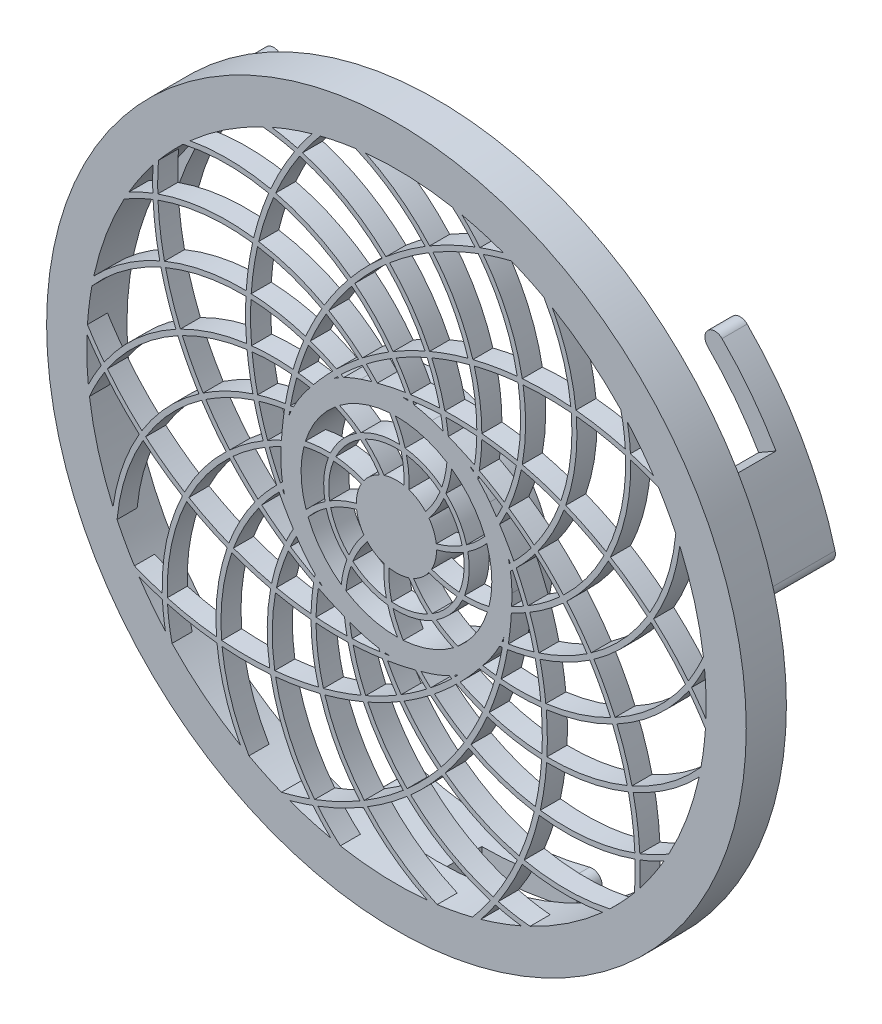
from build123d import *

# Parameters (mm, degrees)
SKETCH_1_R               = 34.85
EXTRUDE_1_DEPTH          = 4
EXTRUDE_2_DEPTH          = 7
SKETCH_2_W               = 4.5
SKETCH_2_H               = 3.119336606
CUT_REVOLVE_1_ANGLE      = 30
PATTERN_CIRCULAR_1_COUNT = 3
SKETCH_3_R               = 30.85
SKETCH_3_R_2             = 11.5
SKETCH_3_R_3             = 9.5
SKETCH_3_R_4             = 4
CUT_EXTRUDE_1_DEPTH      = 51.497970256
EXTRUDE_START            = -2
EXTRUDE_1_2_DEPTH        = 2
EXTRUDE_2_2_DEPTH        = 2
EXTRUDE_3_DEPTH          = 2


# Read off the part's stored shape, not the designer's step: 拉伸-薄壁1
with BuildPart() as part:
    # 草图1 → Extrude 1 (new body)
    with BuildSketch(Plane.XY):
        Circle(SKETCH_1_R)
    extrude(amount=EXTRUDE_1_DEPTH)

    # 草图1<4> → Extrude 2 (add)
    with BuildSketch(Plane.XY):
        with BuildLine():
            ThreePointArc((22.521350971, 22.521350991), (27.582909092, 15.925000032), (30.764737552, 8.243386644))
            ThreePointArc((30.764737552, 8.243386644), (31.989482379, 7.536279789), (32.696589236, 8.761024615))
            ThreePointArc((32.696589236, 8.761024615), (29.314959928, 16.924999982), (23.935564527, 23.935564559))
            ThreePointArc((23.935564527, 23.935564559), (22.521350978, 23.93556454), (22.521350971, 22.521350991))
        make_face()
        with BuildLine():
            ThreePointArc((-8.761024725, -32.696589207), (-5.1e-08, -33.85), (8.761024627, -32.696589233))
            ThreePointArc((8.761024627, -32.696589233), (9.468131465, -31.471844375), (8.24338659, -30.764737566))
            ThreePointArc((8.24338659, -30.764737566), (5.8e-08, -31.85), (-8.243386478, -30.764737596))
            ThreePointArc((-8.243386478, -30.764737596), (-9.468131437, -31.47184427), (-8.761024725, -32.696589207))
        make_face()
        with BuildLine():
            ThreePointArc((-30.764737568, 8.243386584), (-27.582909111, 15.924999999), (-22.521350981, 22.521350981))
            ThreePointArc((-22.521350981, 22.521350981), (-22.52135097, 23.935564533), (-23.935564523, 23.935564564))
            ThreePointArc((-23.935564523, 23.935564564), (-29.314959921, 16.924999995), (-32.69658923, 8.761024638))
            ThreePointArc((-32.69658923, 8.761024638), (-31.989482421, 7.536279801), (-30.764737568, 8.243386584))
        make_face()
    extrude(amount=-EXTRUDE_2_DEPTH)

    # 草图2 → 切除-旋转1 (revolve, cut)
    with BuildSketch(Plane(origin=(0, 0, 0), x_dir=(0, 0, -1), z_dir=(1, 0, 0))):
        with Locations((2.25, -32.290331697)):
            Rectangle(SKETCH_2_W, SKETCH_2_H)
    cut_revolve_1 = revolve(axis=Axis((0, 0, 0), (0, 0, 1)), revolution_arc=CUT_REVOLVE_1_ANGLE, mode=Mode.SUBTRACT)

    # 阵列(圆周)1: 切除-旋转1 ×3 about axis
    pattern_circular_1_axis = Axis((0, 0, 0), (0, 0, 1))
    for i in range(1, PATTERN_CIRCULAR_1_COUNT):
        add(cut_revolve_1.rotate(pattern_circular_1_axis, i * 360 / PATTERN_CIRCULAR_1_COUNT), mode=Mode.SUBTRACT)

    # 草图3 → 切除-拉伸1 (cut, through all)
    # profile 1 of 2: a face of its own
    with BuildSketch(Plane.XY.offset(4)):
        Circle(SKETCH_3_R)
        Circle(SKETCH_3_R_2, mode=Mode.SUBTRACT)
    # profile 2 of 2: a face of its own
    with BuildSketch(Plane.XY.offset(4)):
        Circle(SKETCH_3_R_3)
        Circle(SKETCH_3_R_4, mode=Mode.SUBTRACT)
    extrude(amount=-CUT_EXTRUDE_1_DEPTH, mode=Mode.SUBTRACT)


with BuildPart() as cut_extrude_1_piece_1:
    # of the separate pieces the step leaves, piece 1, a body of its own (cut_extrude_1_pieces)
    add(part.part.solids().sort_by_distance((34.85, 0, 0))[0])



with BuildPart() as cut_extrude_1_piece_2:
    # of the separate pieces the step leaves, piece 2, a body of its own (cut_extrude_1_pieces)
    add(part.part.solids().sort_by_distance((11.5, 0, 0))[0])



with BuildPart() as cut_extrude_1_piece_3:
    # of the separate pieces the step leaves, piece 3, a body of its own (cut_extrude_1_pieces)
    add(part.part.solids().sort_by_distance((4, 0, 0))[0])


with BuildPart() as cut_extrude_1_piece_2_1:
    add(cut_extrude_1_piece_2.part)

    add(cut_extrude_1_piece_3.part)  # Extrude 1 2 merges 切除-拉伸1 piece 3
    # Extrude 1 2 outline → Extrude 1 2 (add)
    with BuildSketch(Plane.XY.offset(4).offset(EXTRUDE_START)):
        with BuildLine():
            ThreePointArc((-6.114773729, 7.270456811), (-5.012586681, 6.729953616), (-3.987053322, 6.055237882))
            ThreePointArc((-3.987053322, 6.055237882), (-5.491731551, 4.733221375), (-6.577258445, 3.049946121))
            ThreePointArc((-6.577258445, 3.049946121), (-7.828797496, 3.018565511), (-9.067175577, 2.834841628))
            ThreePointArc((-9.067175577, 2.834841628), (-9.147890158, 2.562441346), (-9.220423155, 2.287749298))
            ThreePointArc((-9.220423155, 2.287749298), (-8.011035295, 2.498322319), (-6.784773421, 2.555259208))
            ThreePointArc((-6.784773421, 2.555259208), (-7.225021873, 0.601297715), (-7.113827209, -1.398557271))
            ThreePointArc((-7.113827209, -1.398557271), (-8.10789851, -2.159580914), (-9.001777234, -3.03611703))
            ThreePointArc((-9.001777234, -3.03611703), (-8.906963834, -3.303936328), (-8.804184326, -3.568800689))
            ThreePointArc((-8.804184326, -3.568800689), (-7.949540711, -2.687583188), (-6.990940679, -1.920741633))
            ThreePointArc((-6.990940679, -1.920741633), (-6.198599409, -3.760301235), (-4.933155769, -5.312859321))
            ThreePointArc((-4.933155769, -5.312859321), (-5.290057871, -6.512840832), (-5.498005948, -7.747382177))
            ThreePointArc((-5.498005948, -7.747382177), (-5.263880062, -7.908322622), (-5.025046328, -8.062190112))
            ThreePointArc((-5.025046328, -8.062190112), (-4.85159177, -6.846923265), (-4.526806211, -5.663084453))
            ThreePointArc((-4.526806211, -5.663084453), (-2.804522654, -6.68559292), (-0.868186497, -7.197829687))
            ThreePointArc((-0.868186497, -7.197829687), (-0.451594928, -8.378416915), (0.105816741, -9.499410656))
            ThreePointArc((0.105816741, -9.499410656), (0.389826981, -9.491998468), (0.673488572, -9.476096936))
            ThreePointArc((0.673488572, -9.476096936), (0.099500327, -8.390971373), (-0.333585631, -7.242321494))
            ThreePointArc((-0.333585631, -7.242321494), (1.660786433, -7.057215345), (3.528400508, -6.333473759))
            ThreePointArc((3.528400508, -6.333473759), (4.559361929, -7.043722509), (5.669221031, -7.622987138))
            ThreePointArc((5.669221031, -7.622987138), (5.894633367, -7.450053521), (6.114773729, -7.270456811))
            ThreePointArc((6.114773729, -7.270456811), (5.012586681, -6.729953616), (3.987053322, -6.055237882))
            ThreePointArc((3.987053322, -6.055237882), (5.491731551, -4.733221375), (6.577258445, -3.049946121))
            ThreePointArc((6.577258445, -3.049946121), (7.828797496, -3.018565511), (9.067175577, -2.834841628))
            ThreePointArc((9.067175577, -2.834841628), (9.147890158, -2.562441346), (9.220423155, -2.287749298))
            ThreePointArc((9.220423155, -2.287749298), (8.011035295, -2.498322319), (6.784773421, -2.555259208))
            ThreePointArc((6.784773421, -2.555259208), (7.225021873, -0.601297715), (7.113827209, 1.398557271))
            ThreePointArc((7.113827209, 1.398557271), (8.10789851, 2.159580914), (9.001777234, 3.03611703))
            ThreePointArc((9.001777234, 3.03611703), (8.906963834, 3.303936328), (8.804184326, 3.568800689))
            ThreePointArc((8.804184326, 3.568800689), (7.949540711, 2.687583188), (6.990940679, 1.920741633))
            ThreePointArc((6.990940679, 1.920741633), (6.198599409, 3.760301235), (4.933155769, 5.312859321))
            ThreePointArc((4.933155769, 5.312859321), (5.290057871, 6.512840832), (5.498005948, 7.747382177))
            ThreePointArc((5.498005948, 7.747382177), (5.263880062, 7.908322622), (5.025046328, 8.062190112))
            ThreePointArc((5.025046328, 8.062190112), (4.85159177, 6.846923265), (4.526806211, 5.663084453))
            ThreePointArc((4.526806211, 5.663084453), (2.804522654, 6.68559292), (0.868186497, 7.197829687))
            ThreePointArc((0.868186497, 7.197829687), (0.451594928, 8.378416915), (-0.105816741, 9.499410656))
            ThreePointArc((-0.105816741, 9.499410656), (-0.389826981, 9.491998468), (-0.673488572, 9.476096936))
            ThreePointArc((-0.673488572, 9.476096936), (-0.099500327, 8.390971373), (0.333585631, 7.242321494))
            ThreePointArc((0.333585631, 7.242321494), (-1.660786433, 7.057215345), (-3.528400508, 6.333473759))
            ThreePointArc((-3.528400508, 6.333473759), (-4.559361929, 7.043722509), (-5.669221031, 7.622987138))
            ThreePointArc((-5.669221031, 7.622987138), (-5.894633367, 7.450053521), (-6.114773729, 7.270456811))
        make_face()
        with BuildLine():
            ThreePointArc((-3.573667113, 5.726377857), (-2.561010435, 4.741261129), (-1.701352731, 3.620137965))
            ThreePointArc((-1.701352731, 3.620137965), (-1.466982104, 3.721285196), (-1.226637159, 3.80727741))
            ThreePointArc((-1.226637159, 3.80727741), (-2.092360489, 4.965111554), (-3.112371876, 5.98962781))
            ThreePointArc((-3.112371876, 5.98962781), (-1.370238912, 6.609458777), (0.474723027, 6.733285828))
            ThreePointArc((0.474723027, 6.733285828), (0.714942404, 5.341084992), (0.751440434, 3.92878318))
            ThreePointArc((0.751440434, 3.92878318), (1.000503106, 3.87285341), (1.245491206, 3.801151359))
            ThreePointArc((1.245491206, 3.801151359), (1.225664154, 5.246718264), (1.002653153, 6.675116977))
            ThreePointArc((1.002653153, 6.675116977), (2.776395829, 6.152570699), (4.341785106, 5.168307469))
            ThreePointArc((4.341785106, 5.168307469), (3.717811545, 3.900795926), (2.917208894, 2.736766755))
            ThreePointArc((2.917208894, 2.736766755), (3.085830134, 2.545123255), (3.241884263, 2.343114685))
            ThreePointArc((3.241884263, 2.343114685), (4.075526749, 3.524256926), (4.734698756, 4.810938337))
            ThreePointArc((4.734698756, 4.810938337), (5.862541729, 3.345609732), (6.550432846, 1.629211321))
            ThreePointArc((6.550432846, 1.629211321), (5.300603039, 0.970535399), (3.968702709, 0.499398449))
            ThreePointArc((3.968702709, 0.499398449), (3.992474935, 0.245242523), (3.999987719, -0.009912159))
            ThreePointArc((3.999987719, -0.009912159), (5.368676648, 0.455649228), (6.658250362, 1.109144771))
            ThreePointArc((6.658250362, 1.109144771), (6.709395949, -0.73926044), (6.25703788, -2.532188177))
            ThreePointArc((6.25703788, -2.532188177), (4.858744333, -2.330436663), (3.50428698, -1.928723091))
            ThreePointArc((3.50428698, -1.928723091), (3.37413001, -2.148312518), (3.230231821, -2.359152895))
            ThreePointArc((3.230231821, -2.359152895), (4.611174541, -2.787000989), (6.038576634, -3.0163044))
            ThreePointArc((6.038576634, -3.0163044), (4.993488961, -4.54175825), (3.573667113, -5.726377857))
            ThreePointArc((3.573667113, -5.726377857), (2.561010435, -4.741261129), (1.701352731, -3.620137965))
            ThreePointArc((1.701352731, -3.620137965), (1.466982104, -3.721285196), (1.226637159, -3.80727741))
            ThreePointArc((1.226637159, -3.80727741), (2.092360489, -4.965111554), (3.112371876, -5.98962781))
            ThreePointArc((3.112371876, -5.98962781), (1.370238912, -6.609458777), (-0.474723027, -6.733285828))
            ThreePointArc((-0.474723027, -6.733285828), (-0.714942404, -5.341084992), (-0.751440434, -3.92878318))
            ThreePointArc((-0.751440434, -3.92878318), (-1.000503106, -3.87285341), (-1.245491206, -3.801151359))
            ThreePointArc((-1.245491206, -3.801151359), (-1.225664154, -5.246718264), (-1.002653153, -6.675116977))
            ThreePointArc((-1.002653153, -6.675116977), (-2.776395829, -6.152570699), (-4.341785106, -5.168307469))
            ThreePointArc((-4.341785106, -5.168307469), (-3.717811545, -3.900795926), (-2.917208894, -2.736766755))
            ThreePointArc((-2.917208894, -2.736766755), (-3.085830134, -2.545123255), (-3.241884263, -2.343114685))
            ThreePointArc((-3.241884263, -2.343114685), (-4.075526749, -3.524256926), (-4.734698756, -4.810938337))
            ThreePointArc((-4.734698756, -4.810938337), (-5.862541729, -3.345609732), (-6.550432846, -1.629211321))
            ThreePointArc((-6.550432846, -1.629211321), (-5.300603039, -0.970535399), (-3.968702709, -0.499398449))
            ThreePointArc((-3.968702709, -0.499398449), (-3.992474935, -0.245242523), (-3.999987719, 0.009912159))
            ThreePointArc((-3.999987719, 0.009912159), (-5.368676648, -0.455649228), (-6.658250362, -1.109144771))
            ThreePointArc((-6.658250362, -1.109144771), (-6.709395949, 0.73926044), (-6.25703788, 2.532188177))
            ThreePointArc((-6.25703788, 2.532188177), (-4.858744333, 2.330436663), (-3.50428698, 1.928723091))
            ThreePointArc((-3.50428698, 1.928723091), (-3.37413001, 2.148312518), (-3.230231821, 2.359152895))
            ThreePointArc((-3.230231821, 2.359152895), (-4.611174541, 2.787000989), (-6.038576634, 3.0163044))
            ThreePointArc((-6.038576634, 3.0163044), (-4.993488961, 4.54175825), (-3.573667113, 5.726377857))
        make_face(mode=Mode.SUBTRACT)
    extrude(amount=EXTRUDE_1_2_DEPTH)


with BuildPart() as cut_extrude_1_piece_1_1:
    add(cut_extrude_1_piece_1.part)

    add(cut_extrude_1_piece_2_1.part)  # Extrude 2 2 merges 切除-拉伸1 piece 2
    # 草图6 → Extrude 2 2 (add)
    with BuildSketch(Plane.XY.offset(4)):
        with BuildLine():
            ThreePointArc((-11.5, 0), (-3.860679775, 20), (15.166666667, 29.8142397))
            Line((15.166666667, 29.8142397), (15.222222222, 29.317335705))
            ThreePointArc((15.222222222, 29.317335705), (-3.488001779, 19.666666667), (-11, 0))
            Line((-11, 0), (-11.5, 0))
        make_face()
        with BuildLine():
            ThreePointArc((-9.303695435, 6.759530401), (8.632349498, 18.449590523), (29.794461485, 15.205483599))
            Line((29.794461485, 15.205483599), (29.547334034, 14.770825086))
            ThreePointArc((29.547334034, 14.770825086), (8.737923913, 17.960863562), (-8.899186938, 6.465637775))
            Line((-8.899186938, 6.465637775), (-9.303695435, 6.759530401))
        make_face()
        with BuildLine():
            ThreePointArc((-3.553695435, 10.937149937), (17.828114666, 9.852064545), (33.041784693, -5.211250422))
            Line((33.041784693, -5.211250422), (32.586368521, -5.417638674))
            ThreePointArc((32.586368521, -5.417638674), (17.626259661, 9.394621043), (-3.399186938, 10.461621679))
            Line((-3.399186938, 10.461621679), (-3.553695435, 10.937149937))
        make_face()
        with BuildLine():
            ThreePointArc((3.553695435, 10.937149937), (20.214145986, -2.50861523), (23.668269197, -23.637463905))
            Line((23.668269197, -23.637463905), (23.178517804, -23.5367486))
            ThreePointArc((23.178517804, -23.5367486), (19.781963313, -2.760047402), (3.399186938, 10.461621679))
            Line((3.399186938, 10.461621679), (3.553695435, 10.937149937))
        make_face()
        with BuildLine():
            ThreePointArc((9.303695435, 6.759530401), (14.879060594, -13.911089252), (5.254279323, -33.034969585))
            Line((5.254279323, -33.034969585), (4.917261094, -32.665620544))
            ThreePointArc((4.917261094, -32.665620544), (14.381629344, -13.860471551), (8.899186938, 6.465637775))
            Line((8.899186938, 6.465637775), (9.303695435, 6.759530401))
        make_face()
        with BuildLine():
            ThreePointArc((11.5, 0), (3.860679775, -20), (-15.166666667, -29.8142397))
            Line((-15.166666667, -29.8142397), (-15.222222222, -29.317335705))
            ThreePointArc((-15.222222222, -29.317335705), (3.488001779, -19.666666667), (11, 0))
            Line((11, 0), (11.5, 0))
        make_face()
        with BuildLine():
            ThreePointArc((9.303695435, -6.759530401), (-8.632349498, -18.449590523), (-29.794461485, -15.205483599))
            Line((-29.794461485, -15.205483599), (-29.547334034, -14.770825086))
            ThreePointArc((-29.547334034, -14.770825086), (-8.737923913, -17.960863562), (8.899186938, -6.465637775))
            Line((8.899186938, -6.465637775), (9.303695435, -6.759530401))
        make_face()
        with BuildLine():
            ThreePointArc((3.553695435, -10.937149937), (-17.828114666, -9.852064545), (-33.041784693, 5.211250422))
            Line((-33.041784693, 5.211250422), (-32.586368521, 5.417638674))
            ThreePointArc((-32.586368521, 5.417638674), (-17.626259661, -9.394621043), (3.399186938, -10.461621679))
            Line((3.399186938, -10.461621679), (3.553695435, -10.937149937))
        make_face()
        with BuildLine():
            ThreePointArc((-3.553695435, -10.937149937), (-20.214145986, 2.50861523), (-23.668269197, 23.637463905))
            Line((-23.668269197, 23.637463905), (-23.178517804, 23.5367486))
            ThreePointArc((-23.178517804, 23.5367486), (-19.781963313, 2.760047402), (-3.399186938, -10.461621679))
            Line((-3.399186938, -10.461621679), (-3.553695435, -10.937149937))
        make_face()
        with BuildLine():
            ThreePointArc((-9.303695435, -6.759530401), (-14.879060594, 13.911089252), (-5.254279323, 33.034969585))
            Line((-5.254279323, 33.034969585), (-4.917261094, 32.665620544))
            ThreePointArc((-4.917261094, 32.665620544), (-14.381629344, 13.860471551), (-8.899186938, -6.465637775))
            Line((-8.899186938, -6.465637775), (-9.303695435, -6.759530401))
        make_face()
    extrude(amount=-EXTRUDE_2_2_DEPTH)

    # 草图7 → 拉伸-薄壁3 (add)
    with BuildSketch(Plane.XY.offset(4)):
        with BuildLine():
            ThreePointArc((-7.424621202, 7.424621202), (-21.788265139, 5.57217678), (-31.13561629, -5.490049213))
            Line((-31.13561629, -5.490049213), (-31.608460632, -5.327512361))
            ThreePointArc((-31.608460632, -5.327512361), (-22.027425702, 6.011269281), (-7.304690667, 7.910024815))
            Line((-7.304690667, 7.910024815), (-7.424621202, 7.424621202))
        make_face()
        with BuildLine():
            ThreePointArc((-4.766900247, 9.355568504), (-18.999974218, 12.032399242), (-31.308249269, 4.400087485))
            Line((-31.308249269, 4.400087485), (-31.707724312, 4.700786155))
            ThreePointArc((-31.707724312, 4.700786155), (-19.091742385, 12.523905705), (-4.502841565, 9.780154199))
            Line((-4.502841565, 9.780154199), (-4.766900247, 9.355568504))
        make_face()
        with BuildLine():
            ThreePointArc((-1.642561883, 10.370727576), (-14.351833441, 17.314806632), (-28.416212671, 13.859512963))
            Line((-28.416212671, 13.859512963), (-28.703215015, 14.268938969))
            ThreePointArc((-28.703215015, 14.268938969), (-14.287226304, 17.81061498), (-1.260222957, 10.692933948))
            Line((-1.260222957, 10.692933948), (-1.642561883, 10.370727576))
        make_face()
        with BuildLine():
            ThreePointArc((1.642561883, 10.370727576), (-8.298835211, 20.902320109), (-22.74259919, 21.962272748))
            Line((-22.74259919, 21.962272748), (-22.889035045, 22.44034862))
            ThreePointArc((-22.889035045, 22.44034862), (-8.084176967, 21.353897166), (2.105755054, 10.55901482))
            Line((2.105755054, 10.55901482), (1.642561883, 10.370727576))
        make_face()
        with BuildLine():
            ThreePointArc((4.766900247, 9.355568504), (-1.43348917, 22.443768859), (-14.842781643, 27.915212255))
            Line((-14.842781643, 27.915212255), (-14.834316848, 28.415140597))
            ThreePointArc((-14.834316848, 28.415140597), (-1.089792063, 22.806911117), (5.265607089, 9.391505752))
            Line((5.265607089, 9.391505752), (4.766900247, 9.355568504))
        make_face()
        with BuildLine():
            ThreePointArc((7.424621202, 7.424621202), (5.57217678, 21.788265139), (-5.490049213, 31.13561629))
            Line((-5.490049213, 31.13561629), (-5.327512361, 31.608460632))
            ThreePointArc((-5.327512361, 31.608460632), (6.011269281, 22.027425702), (7.910024815, 7.304690667))
            Line((7.910024815, 7.304690667), (7.424621202, 7.424621202))
        make_face()
        with BuildLine():
            ThreePointArc((9.355568504, 4.766900247), (12.032399242, 18.999974218), (4.400087485, 31.308249269))
            Line((4.400087485, 31.308249269), (4.700786155, 31.707724312))
            ThreePointArc((4.700786155, 31.707724312), (12.523905705, 19.091742385), (9.780154199, 4.502841565))
            Line((9.780154199, 4.502841565), (9.355568504, 4.766900247))
        make_face()
        with BuildLine():
            ThreePointArc((10.370727576, 1.642561883), (17.314806632, 14.351833441), (13.859512963, 28.416212671))
            Line((13.859512963, 28.416212671), (14.268938969, 28.703215015))
            ThreePointArc((14.268938969, 28.703215015), (17.81061498, 14.287226304), (10.692933948, 1.260222957))
            Line((10.692933948, 1.260222957), (10.370727576, 1.642561883))
        make_face()
        with BuildLine():
            ThreePointArc((10.370727576, -1.642561883), (20.902320109, 8.298835211), (21.962272748, 22.74259919))
            Line((21.962272748, 22.74259919), (22.44034862, 22.889035045))
            ThreePointArc((22.44034862, 22.889035045), (21.353897166, 8.084176967), (10.55901482, -2.105755054))
            Line((10.55901482, -2.105755054), (10.370727576, -1.642561883))
        make_face()
        with BuildLine():
            ThreePointArc((9.355568504, -4.766900247), (22.443768859, 1.43348917), (27.915212255, 14.842781643))
            Line((27.915212255, 14.842781643), (28.415140597, 14.834316848))
            ThreePointArc((28.415140597, 14.834316848), (22.806911117, 1.089792063), (9.391505752, -5.265607089))
            Line((9.391505752, -5.265607089), (9.355568504, -4.766900247))
        make_face()
        with BuildLine():
            ThreePointArc((7.424621202, -7.424621202), (21.788265139, -5.57217678), (31.13561629, 5.490049213))
            Line((31.13561629, 5.490049213), (31.608460632, 5.327512361))
            ThreePointArc((31.608460632, 5.327512361), (22.027425702, -6.011269281), (7.304690667, -7.910024815))
            Line((7.304690667, -7.910024815), (7.424621202, -7.424621202))
        make_face()
        with BuildLine():
            ThreePointArc((4.766900247, -9.355568504), (18.999974218, -12.032399242), (31.308249269, -4.400087485))
            Line((31.308249269, -4.400087485), (31.707724312, -4.700786155))
            ThreePointArc((31.707724312, -4.700786155), (19.091742385, -12.523905705), (4.502841565, -9.780154199))
            Line((4.502841565, -9.780154199), (4.766900247, -9.355568504))
        make_face()
        with BuildLine():
            ThreePointArc((1.642561883, -10.370727576), (14.351833441, -17.314806632), (28.416212671, -13.859512963))
            Line((28.416212671, -13.859512963), (28.703215015, -14.268938969))
            ThreePointArc((28.703215015, -14.268938969), (14.287226304, -17.81061498), (1.260222957, -10.692933948))
            Line((1.260222957, -10.692933948), (1.642561883, -10.370727576))
        make_face()
        with BuildLine():
            ThreePointArc((-1.642561883, -10.370727576), (8.298835211, -20.902320109), (22.74259919, -21.962272748))
            Line((22.74259919, -21.962272748), (22.889035045, -22.44034862))
            ThreePointArc((22.889035045, -22.44034862), (8.084176967, -21.353897166), (-2.105755054, -10.55901482))
            Line((-2.105755054, -10.55901482), (-1.642561883, -10.370727576))
        make_face()
        with BuildLine():
            ThreePointArc((-4.766900247, -9.355568504), (1.43348917, -22.443768859), (14.842781643, -27.915212255))
            Line((14.842781643, -27.915212255), (14.834316848, -28.415140597))
            ThreePointArc((14.834316848, -28.415140597), (1.089792063, -22.806911117), (-5.265607089, -9.391505752))
            Line((-5.265607089, -9.391505752), (-4.766900247, -9.355568504))
        make_face()
        with BuildLine():
            ThreePointArc((-7.424621202, -7.424621202), (-5.57217678, -21.788265139), (5.490049213, -31.13561629))
            Line((5.490049213, -31.13561629), (5.327512361, -31.608460632))
            ThreePointArc((5.327512361, -31.608460632), (-6.011269281, -22.027425702), (-7.910024815, -7.304690667))
            Line((-7.910024815, -7.304690667), (-7.424621202, -7.424621202))
        make_face()
        with BuildLine():
            ThreePointArc((-9.355568504, -4.766900247), (-12.032399242, -18.999974218), (-4.400087485, -31.308249269))
            Line((-4.400087485, -31.308249269), (-4.700786155, -31.707724312))
            ThreePointArc((-4.700786155, -31.707724312), (-12.523905705, -19.091742385), (-9.780154199, -4.502841565))
            Line((-9.780154199, -4.502841565), (-9.355568504, -4.766900247))
        make_face()
        with BuildLine():
            ThreePointArc((-10.370727576, -1.642561883), (-17.314806632, -14.351833441), (-13.859512963, -28.416212671))
            Line((-13.859512963, -28.416212671), (-14.268938969, -28.703215015))
            ThreePointArc((-14.268938969, -28.703215015), (-17.81061498, -14.287226304), (-10.692933948, -1.260222957))
            Line((-10.692933948, -1.260222957), (-10.370727576, -1.642561883))
        make_face()
        with BuildLine():
            ThreePointArc((-10.370727576, 1.642561883), (-20.902320109, -8.298835211), (-21.962272748, -22.74259919))
            Line((-21.962272748, -22.74259919), (-22.44034862, -22.889035045))
            ThreePointArc((-22.44034862, -22.889035045), (-21.353897166, -8.084176967), (-10.55901482, 2.105755054))
            Line((-10.55901482, 2.105755054), (-10.370727576, 1.642561883))
        make_face()
        with BuildLine():
            ThreePointArc((-9.355568504, 4.766900247), (-22.443768859, -1.43348917), (-27.915212255, -14.842781643))
            Line((-27.915212255, -14.842781643), (-28.415140597, -14.834316848))
            ThreePointArc((-28.415140597, -14.834316848), (-22.806911117, -1.089792063), (-9.391505752, 5.265607089))
            Line((-9.391505752, 5.265607089), (-9.355568504, 4.766900247))
        make_face()
    extrude(amount=-EXTRUDE_3_DEPTH)


solid = cut_extrude_1_piece_1_1.part
